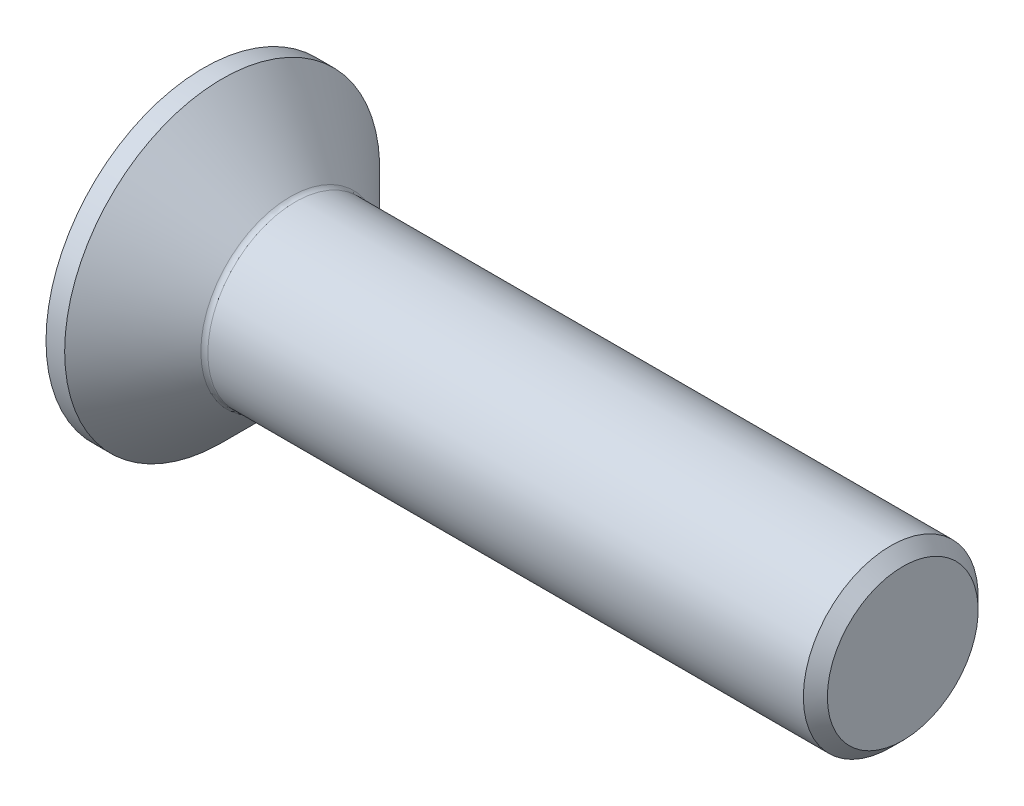
from build123d import *

# Parameters (mm, degrees)
FILLET1_R   = 0.8
HEX_START   = -5.6
HEX_2_DEPTH = 5.6


with BuildPart() as part:
    # BodySke → BaseBody (revolve)
    with BuildSketch(Plane.XY, mode=Mode.PRIVATE) as basebody_sk:
        Polygon((0, 0), (0, 18.025), (2.135, 18.025), (10.16, 10), (78.626, 10), (80, 8.626), (80, 0), align=None)
    revolve(basebody_sk.sketch.rotate(Axis((0, 0, 0), (1, 0, 0)), 90), axis=Axis((0, 0, 0), (1, 0, 0)))

    # Fillet1
    fillet1_edges = [part.edges().sort_by_distance(p)[0] for p in [
        (10.16, 0, -10),
    ]]
    fillet(fillet1_edges, radius=FILLET1_R)

    # Hex 2: read off the stored shape, not the designer's step
    # Hex 2 outline → Hex 2 (cut)
    with BuildSketch(Plane.ZY.offset(HEX_START)):
        Polygon((-6, -3.464101615), (0, -6.92820323), (6, -3.464101615), (6, 3.464101615), (0, 6.92820323), (-6, 3.464101615), align=None)
    extrude(amount=HEX_2_DEPTH, mode=Mode.SUBTRACT)

    # Hex 2 2 outline → Hex 2 2 (revolve, cut)
    with BuildSketch(Plane.YX):
        Polygon((6, 5.6), (0, 9.064101615), (0, 5.6), align=None)
    revolve(axis=Axis((0, 0, 0), (1, 0, 0)), mode=Mode.SUBTRACT)


solid = part.part
